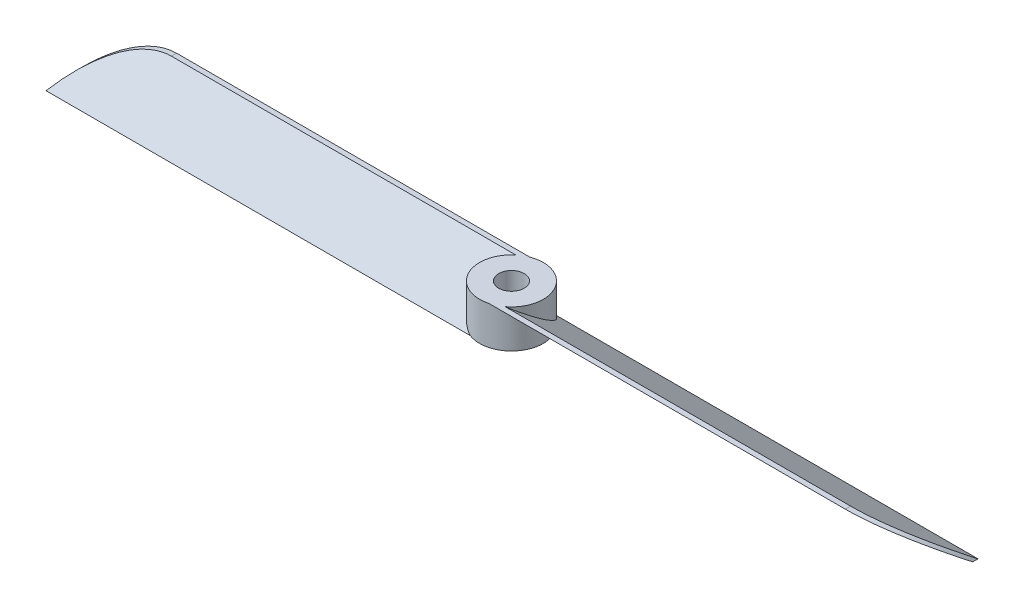
from build123d import *

# Parameters (mm, degrees)
SKETCH1_R                = 7.5
SKETCH1_R_2              = 3
BOSS_EXTRUDE1_DEPTH      = 9
BOSS_EXTRUDE2_REACH      = 112.622
BOSS_EXTRUDE2_END_RADIUS = 7.5
BOSS_EXTRUDE3_REACH      = 207.334
BOSS_EXTRUDE3_END_RADIUS = 7.5
FILLET1_START            = -7.245522841
FILLET1_DEPTH            = 14.745522841


with BuildPart() as part:
    # Sketch1 → Boss-Extrude1 (new body)
    with BuildSketch(Plane(origin=(0, 0, 0), x_dir=(1, 0, 0), z_dir=(0, 1, 0))):
        with Locations(Location((0, 0, 0), (0, 0, 270))):
            Circle(SKETCH1_R)
        with Locations(Location((0, 0, 0), (0, 0, 270))):
            Circle(SKETCH1_R_2, mode=Mode.SUBTRACT)
    extrude(amount=BOSS_EXTRUDE1_DEPTH)

    # Boss-Extrude2: up to this cylinder (the profile starts outside it)
    boss_extrude2_end = Plane(origin=(0, 4.5, 0), z_dir=(0, -1, 0)) * Cylinder(BOSS_EXTRUDE2_END_RADIUS, 241.244, mode=Mode.PRIVATE)
    # Sketch3 → Boss-Extrude2 (add, up to the surface)
    with BuildSketch(Plane(origin=(102.5, 0, 0), x_dir=(0, 0, -1), z_dir=(1, 0, 0)), mode=Mode.PRIVATE) as boss_extrude2_sk1:
        Polygon((-6, 9), (7.245522841, 0), (6, 0), (-7.245522841, 9), align=None)
    boss_extrude2_tool1 = extrude(boss_extrude2_sk1.sketch, amount=-BOSS_EXTRUDE2_REACH, mode=Mode.PRIVATE) - boss_extrude2_end
    add(boss_extrude2_tool1.solids().sort_by_distance((102.5, 4.5, 0))[0])

    # Boss-Extrude3: up to this cylinder (the profile starts outside it)
    boss_extrude3_end = Plane(origin=(0, 4.5, 0), z_dir=(0, -1, 0)) * Cylinder(BOSS_EXTRUDE3_END_RADIUS, 430.668, mode=Mode.PRIVATE)
    # Sketch5 → Boss-Extrude3 (add, up to the surface)
    with BuildSketch(Plane(origin=(-102.5, 0, 0), x_dir=(0, 0, -1), z_dir=(1, 0, 0)), mode=Mode.PRIVATE) as boss_extrude3_sk1:
        Polygon((5.784000547, 9), (-7, 0), (-5.784000547, 0), (7, 9), align=None)
    boss_extrude3_tool1 = extrude(boss_extrude3_sk1.sketch, amount=BOSS_EXTRUDE3_REACH, mode=Mode.PRIVATE) - boss_extrude3_end
    add(boss_extrude3_tool1.solids().sort_by_distance((-102.5, 4.5, 0))[0])

    # Fillet1: read off the stored shape, not the designer's step
    # Fillet1 outline → Fillet1 (cut)
    with BuildSketch(Plane.XY.offset(FILLET1_START)):
        with BuildLine():
            ThreePointArc((-102.5, 0), (-95.283539892, 6.606816862), (-85.796706912, 9))
            Line((-85.796706912, 9), (-102.5, 9))
            Line((-102.5, 9), (-102.5, 0))
        make_face()
        with BuildLine():
            ThreePointArc((85.796706911, 9), (95.283539892, 6.606816862), (102.5, 0))
            Line((102.5, 0), (102.5, 9))
            Line((102.5, 9), (85.796706911, 9))
        make_face()
    extrude(amount=FILLET1_DEPTH, mode=Mode.SUBTRACT)


solid = part.part
